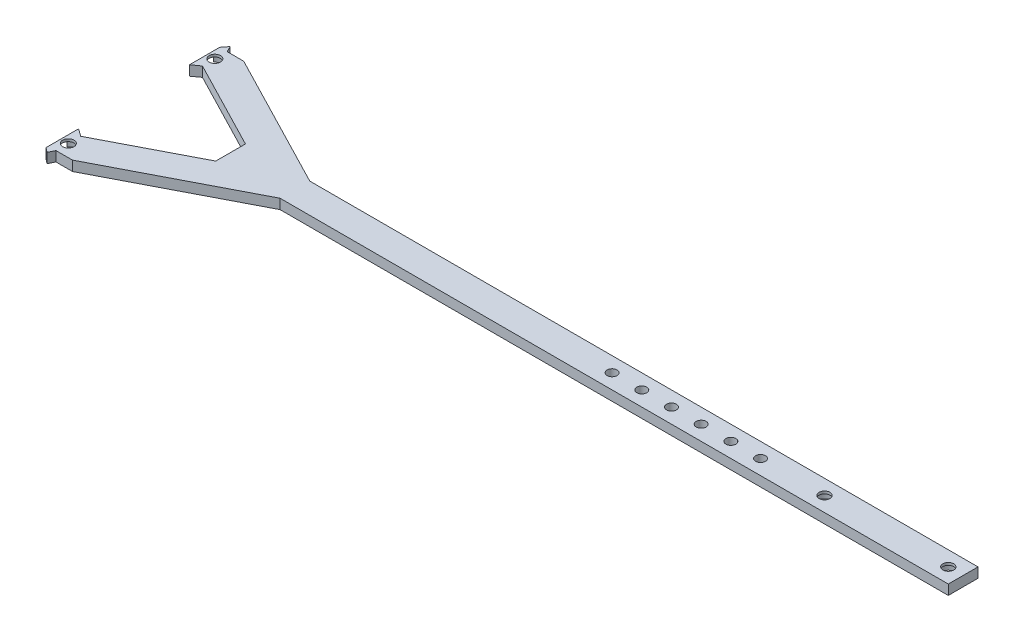
from build123d import *

# Parameters (mm, degrees)
SZKIC1_R                    = 1.10000034
DODANIE_WYCI_GNI_CIE1_DEPTH = 2
SZKIC2_R                    = 1.15000024
DODANIE_WYCI_GNI_CIE3_DEPTH = 2
SZKIC4_R                    = 2
WYTNIJ_WYCI_GNI_CIE2_DEPTH  = 1.5
OBR_T11_ANGLE               = 180
SZKIC7_R                    = 1
WYTNIJ_WYCI_GNI_CIE3_DEPTH  = 3


with BuildPart() as part:
    # Szkic1 → Dodanie-wyciągnięcie1 (new body)
    with BuildSketch(Plane.XZ.offset(0.60108084)):
        Polygon((-159.94986344, 47.133471805), (-28.599998474, 47.133471805), (-11.94976104, 47.133471805), (-11.94976104, 41.133471805), (-28.599998474, 41.133471805), (-159.94986344, 41.133471805), align=None)
        with Locations((-14.94976104, 44.133683448)):
            Circle(SZKIC1_R, mode=Mode.SUBTRACT)
        with Locations((-39.94986344, 44.133683448)):
            Circle(SZKIC1_R, mode=Mode.SUBTRACT)
    extrude(amount=DODANIE_WYCI_GNI_CIE1_DEPTH)

    # Szkic2 → Dodanie-wyciągnięcie3 (add)
    with BuildSketch(Plane(origin=(0, -0.60108084, 0), x_dir=(1, 0, 0), z_dir=(0, 1, 0))):
        Polygon((-177.92986334, -26.833472568), (-178.524863368, -25.633471805), (-179.449863351, -26.833472568), (-179.449863351, -32.933471042), (-177.92986334, -31.833472568), (-159.94986344, -41.133471805), (-159.94986344, -47.133471805), (-177.92986334, -56.433471042), (-179.449863351, -55.333472568), (-179.449863351, -61.920451452), (-178.524863368, -62.633471805), (-177.92986334, -61.433471042), (-174.596530746, -61.433471042), (-146.94986344, -47.133471805), (-146.94986344, -41.133471805), (-174.596530746, -26.833472568), align=None)
        with Locations((-177.929667465, -58.933463325)):
            Circle(SZKIC2_R, mode=Mode.SUBTRACT)
        with Locations((-177.929667465, -29.333481885)):
            Circle(SZKIC2_R, mode=Mode.SUBTRACT)
    extrude(amount=-DODANIE_WYCI_GNI_CIE3_DEPTH)

    # Szkic4 → Wytnij-wyciągnięcie2 (cut)
    with BuildSketch(Plane.XZ.offset(2.60108084)):
        with Locations((-14.94976104, 44.133683448)):
            Circle(SZKIC4_R)
        with Locations((-39.94986344, 44.133683448)):
            Circle(SZKIC4_R)
        with Locations((-177.929667465, 58.933463325)):
            Circle(SZKIC4_R)
        with Locations((-177.929667465, 29.333481885)):
            Circle(SZKIC4_R)
    extrude(amount=-WYTNIJ_WYCI_GNI_CIE2_DEPTH, mode=Mode.SUBTRACT)

    # Szkic6 → Obrót11 (revolve)
    with BuildSketch(Plane.XZ.offset(2.60108084)):
        with BuildLine():
            Line((-158.141900523, 44.133471805), (-152.141900523, 44.133471805))
            ThreePointArc((-152.141900523, 44.133471805), (-155.141900523, 47.133471805), (-158.141900523, 44.133471805))
        make_face()
    revolve(axis=Axis((-158.141900523, -2.60108084, 44.133471805), (1, 0, 0)), revolution_arc=OBR_T11_ANGLE)

    # Szkic7 → Wytnij-wyciągnięcie3 (cut)
    with BuildSketch(Plane(origin=(0, -0.60108084, 0), x_dir=(1, 0, 0), z_dir=(0, 1, 0))):
        with Locations((-52.873214958, -44.133471805)):
            Circle(SZKIC7_R)
        with Locations((-58.873214958, -44.133471805)):
            Circle(SZKIC7_R)
        with Locations((-64.873214958, -44.133471805)):
            Circle(SZKIC7_R)
        with Locations((-70.873214958, -44.133471805)):
            Circle(SZKIC7_R)
        with Locations((-76.873214958, -44.133471805)):
            Circle(SZKIC7_R)
        with Locations((-82.873214958, -44.133471805)):
            Circle(SZKIC7_R)
    extrude(amount=-WYTNIJ_WYCI_GNI_CIE3_DEPTH, mode=Mode.SUBTRACT)


solid = part.part
